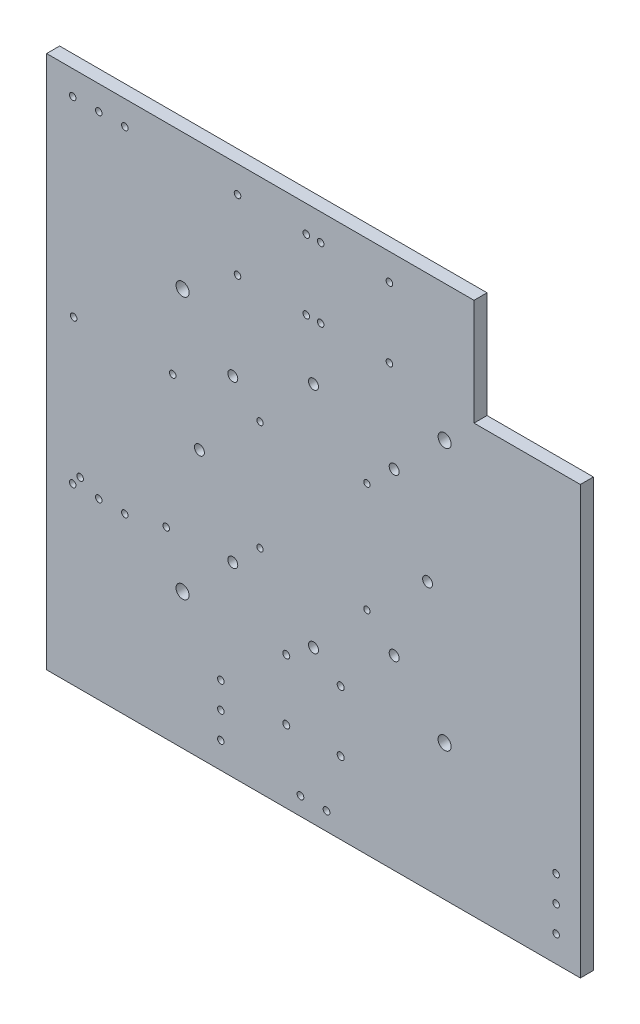
from build123d import *

# Parameters (mm, degrees)
SKETCH1_W           = 260
SKETCH1_H           = 260
SKETCH1_R           = 1.55
SKETCH1_R_2         = 1.5875
SKETCH1_R_3         = 1.6
SKETCH1_R_4         = 1.7
SKETCH1_R_5         = 2.415
SKETCH1_R_6         = 1.651
BOSS_EXTRUDE2_DEPTH = 6.35
SKETCH5_W           = 52.8
SKETCH5_H           = 52.8
CUT_EXTRUDE1_DEPTH  = 184.957393165
SKETCH6_R           = 3.175
CUT_EXTRUDE2_DEPTH  = 184.957393165
SKETCH7_R           = 1.5875
CUT_EXTRUDE3_DEPTH  = 184.957393165


with BuildPart() as part:
    # Sketch1 → Boss-Extrude2 (new body)
    with BuildSketch(Plane.XY):
        Rectangle(SKETCH1_W, SKETCH1_H)
        with Locations((-26.035, 26.67)):
            Circle(SKETCH1_R, mode=Mode.SUBTRACT)
        with Locations((-26.035, -26.67)):
            Circle(SKETCH1_R, mode=Mode.SUBTRACT)
        with Locations((26.035, 26.67)):
            Circle(SKETCH1_R, mode=Mode.SUBTRACT)
        with Locations((26.035, -26.67)):
            Circle(SKETCH1_R, mode=Mode.SUBTRACT)
        with Locations((-116.825, 25.402702903)):
            Circle(SKETCH1_R_2, mode=Mode.SUBTRACT)
        with Locations((-113.65, -40.635194695)):
            Circle(SKETCH1_R_2, mode=Mode.SUBTRACT)
        with Locations((-68.565, 25.404805305)):
            Circle(SKETCH1_R_2, mode=Mode.SUBTRACT)
        with Locations((-37, 117)):
            Circle(SKETCH1_R_3, mode=Mode.SUBTRACT)
        with Locations((-37, 83)):
            Circle(SKETCH1_R_3, mode=Mode.SUBTRACT)
        with Locations((-3.5, 117)):
            Circle(SKETCH1_R_3, mode=Mode.SUBTRACT)
        with Locations((-3.5, 83)):
            Circle(SKETCH1_R_3, mode=Mode.SUBTRACT)
        with Locations((3.5, 117)):
            Circle(SKETCH1_R_3, mode=Mode.SUBTRACT)
        with Locations((37, 117)):
            Circle(SKETCH1_R_3, mode=Mode.SUBTRACT)
        with Locations((37, 83)):
            Circle(SKETCH1_R_3, mode=Mode.SUBTRACT)
        with Locations((3.5, 83)):
            Circle(SKETCH1_R_3, mode=Mode.SUBTRACT)
        with Locations((-13.25, -65.25)):
            Circle(SKETCH1_R_4, mode=Mode.SUBTRACT)
        with Locations((13.25, -65.25)):
            Circle(SKETCH1_R_4, mode=Mode.SUBTRACT)
        with Locations((13.25, -94.75)):
            Circle(SKETCH1_R_4, mode=Mode.SUBTRACT)
        with Locations((-13.25, -94.75)):
            Circle(SKETCH1_R_4, mode=Mode.SUBTRACT)
        with Locations((0, 55.575)):
            Circle(SKETCH1_R_5, mode=Mode.SUBTRACT)
        with Locations((-55.575, 0)):
            Circle(SKETCH1_R_5, mode=Mode.SUBTRACT)
        with Locations((0, -55.575)):
            Circle(SKETCH1_R_5, mode=Mode.SUBTRACT)
        with Locations((55.575, 0)):
            Circle(SKETCH1_R_5, mode=Mode.SUBTRACT)
        with Locations((-39.297459364, 39.297459364)):
            Circle(SKETCH1_R_5, mode=Mode.SUBTRACT)
        with Locations((39.297459364, 39.297459364)):
            Circle(SKETCH1_R_5, mode=Mode.SUBTRACT)
        with Locations((39.297459364, -39.297459364)):
            Circle(SKETCH1_R_5, mode=Mode.SUBTRACT)
        with Locations((-39.297459364, -39.297459364)):
            Circle(SKETCH1_R_5, mode=Mode.SUBTRACT)
        with Locations((-71.74, -40.635194695)):
            Circle(SKETCH1_R_2, mode=Mode.SUBTRACT)
        with Locations((6.35, -121.3)):
            Circle(SKETCH1_R_6, mode=Mode.SUBTRACT)
        with Locations((-6.35, -121.3)):
            Circle(SKETCH1_R_6, mode=Mode.SUBTRACT)
        with Locations((121.3, 126.35)):
            Circle(SKETCH1_R_6, mode=Mode.SUBTRACT)
        with Locations((121.3, 113.65)):
            Circle(SKETCH1_R_6, mode=Mode.SUBTRACT)
    extrude(amount=BOSS_EXTRUDE2_DEPTH)

    # Sketch5 → Cut-Extrude1 (cut, through all)
    with BuildSketch(Plane(origin=(0, 0, 0), x_dir=(-1, 0, 0), z_dir=(0, 0, -1))):
        with Locations((-104.6, 104.6)):
            Rectangle(SKETCH5_W, SKETCH5_H)
    extrude(amount=-CUT_EXTRUDE1_DEPTH, mode=Mode.SUBTRACT)

    # Sketch6 → Cut-Extrude2 (cut, through all)
    with BuildSketch(Plane(origin=(0, 0, 0), x_dir=(-1, 0, 0), z_dir=(0, 0, -1))):
        with Locations((63.77864005, 63.77864005)):
            Circle(SKETCH6_R)
        with Locations((-63.87464005, 63.77864005)):
            Circle(SKETCH6_R)
        with Locations((-63.87464005, -63.87464005)):
            Circle(SKETCH6_R)
        with Locations((63.77864005, -63.87464005)):
            Circle(SKETCH6_R)
    extrude(amount=-CUT_EXTRUDE2_DEPTH, mode=Mode.SUBTRACT)

    # Sketch7 → Cut-Extrude3 (cut, through all)
    with BuildSketch(Plane(origin=(0, 0, 0), x_dir=(-1, 0, 0), z_dir=(0, 0, -1))):
        with Locations((91.9, 118.189)):
            Circle(SKETCH7_R)
        with Locations((104.6, 118.189)):
            Circle(SKETCH7_R)
        with Locations((117.3, 118.189)):
            Circle(SKETCH7_R)
        with Locations((91.9, -45.133)):
            Circle(SKETCH7_R)
        with Locations((104.6, -45.133)):
            Circle(SKETCH7_R)
        with Locations((117.3, -45.133)):
            Circle(SKETCH7_R)
        with Locations((45.133, -117.3)):
            Circle(SKETCH7_R)
        with Locations((45.133, -104.6)):
            Circle(SKETCH7_R)
        with Locations((45.133, -91.9)):
            Circle(SKETCH7_R)
        with Locations((-118.189, -117.3)):
            Circle(SKETCH7_R)
        with Locations((-118.189, -104.6)):
            Circle(SKETCH7_R)
        with Locations((-118.189, -91.9)):
            Circle(SKETCH7_R)
    extrude(amount=-CUT_EXTRUDE3_DEPTH, mode=Mode.SUBTRACT)


solid = part.part
